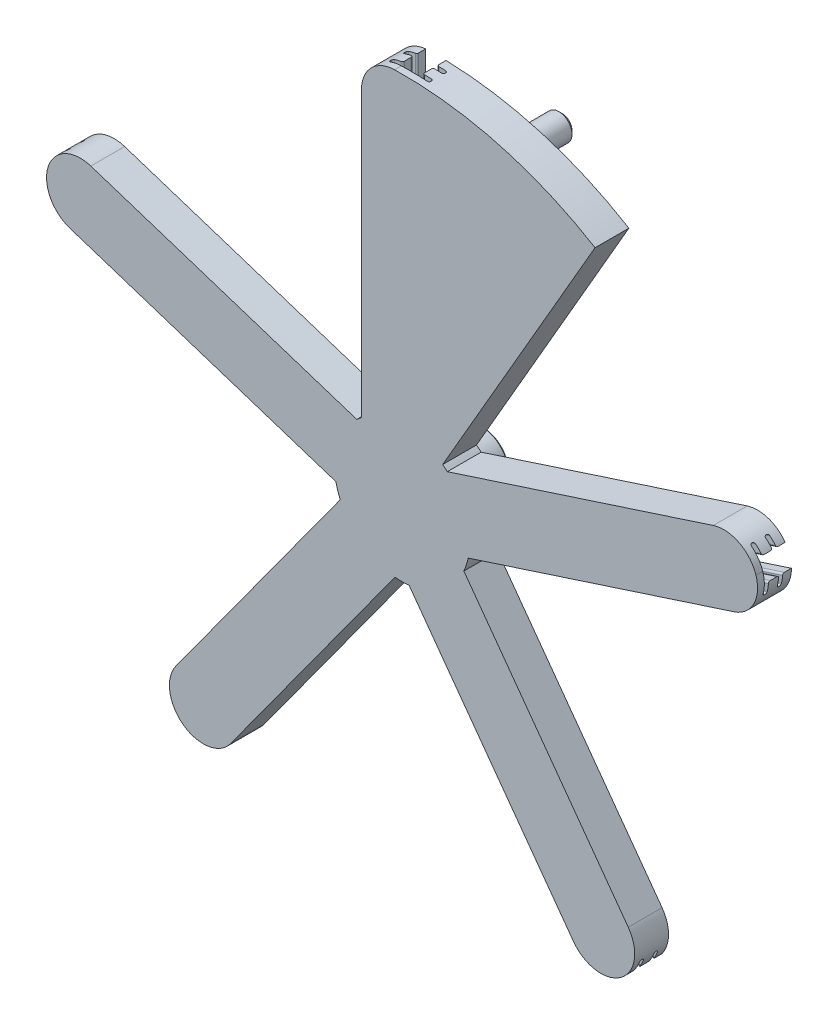
from build123d import *

# Parameters (mm, degrees)
BOSS_EXTRUDE1_DEPTH = 5
FILLET1_R           = 5
CUT_EXTRUDE2_DEPTH  = 51
CIRPATTERN1_COUNT   = 5
SKETCH3_R           = 1.95
BOSS_EXTRUDE2_DEPTH = 7
CHAMFER1_SIZE       = 0.5
SKETCH4_R           = 3.975
BOSS_EXTRUDE3_DEPTH = 7
CHAMFER2_SIZE       = 0.25


with BuildPart() as part:
    # Sketch1 → Boss-Extrude1 (new body)
    with BuildSketch(Plane.XY):
        with BuildLine():
            Line((-50.546425772, 21.680840429), (-6.691306064, 7.431448255))
            ThreePointArc((-6.691306064, 7.431448255), (-6.35201741, 7.723462619), (-6, 8))
            Line((-6, 8), (-6, 54.671747731))
            ThreePointArc((-6, 54.671747731), (11.896337599, 53.698018136), (28.529394067, 47.022055188))
            Line((28.529394067, 47.022055188), (6, 8))
            ThreePointArc((6, 8), (6.35201741, 7.723462619), (6.691306064, 7.431448255))
            Line((6.691306064, 7.431448255), (50.546425772, 21.680840429))
            ThreePointArc((50.546425772, 21.680840429), (52.308108396, 16.995934691), (53.636595716, 12.170275266))
            Line((53.636595716, 12.170275266), (9.781476007, -2.079116908))
            ThreePointArc((9.781476007, -2.079116908), (9.510565163, -3.090169944), (9.135454576, -4.067366431))
            Line((9.135454576, -4.067366431), (36.239409137, -41.372759461))
            ThreePointArc((36.239409137, -41.372759461), (32.328188876, -44.495934691), (28.149239193, -47.250611984))
            Line((28.149239193, -47.250611984), (1.045284633, -9.945218954))
            ThreePointArc((1.045284633, -9.945218954), (0, -10), (-1.045284633, -9.945218954))
            Line((-1.045284633, -9.945218954), (-28.149239193, -47.250611984))
            ThreePointArc((-28.149239193, -47.250611984), (-32.328188876, -44.495934691), (-36.239409137, -41.372759461))
            Line((-36.239409137, -41.372759461), (-9.135454576, -4.067366431))
            ThreePointArc((-9.135454576, -4.067366431), (-9.510565163, -3.090169944), (-9.781476007, -2.079116908))
            Line((-9.781476007, -2.079116908), (-53.636595716, 12.170275266))
            ThreePointArc((-53.636595716, 12.170275266), (-52.308108396, 16.995934691), (-50.546425772, 21.680840429))
        make_face()
    extrude(amount=BOSS_EXTRUDE1_DEPTH)

    # Fillet1
    fillet1_edges = [part.edges().sort_by_distance(p)[0] for p in [
        (50.546425772, 21.680840429, 2.5),
        (53.636595716, 12.170275266, 2.5),
        (36.239409137, -41.372759461, 2.5),
        (28.149239193, -47.250611984, 2.5),
        (-28.149239193, -47.250611984, 2.5),
        (-36.239409137, -41.372759461, 2.5),
        (-53.636595716, 12.170275266, 2.5),
        (-50.546425772, 21.680840429, 2.5),
        (-6, 54.671747731, 2.5),
    ]]
    fillet(fillet1_edges, radius=FILLET1_R - 0.0001)  # a hair under: the kernel refuses the full size

    # Sketch2 → Cut-Extrude2 (cut)
    with BuildSketch(Plane(origin=(-5.090369605, -7.006292692, 0), x_dir=(0.8090169943749478, -0.5877852522924728, 0), z_dir=(0.5877852522924728, 0.8090169943749478, 0))):
        with BuildLine():
            Line((0, 0), (1.5, 0))
            Line((1.5, 0), (1.5, -1.05))
            ThreePointArc((1.5, -1.05), (1.573223305, -1.226776695), (1.75, -1.3))
            Line((1.75, -1.3), (2.75, -1.3))
            ThreePointArc((2.75, -1.3), (2.926776695, -1.373223305), (3, -1.55))
            Line((3, -1.55), (3, -1.65))
            ThreePointArc((3, -1.65), (2.926776695, -1.826776695), (2.75, -1.9))
            Line((2.75, -1.9), (1.75, -1.9))
            ThreePointArc((1.75, -1.9), (1.573223305, -1.973223305), (1.5, -2.15))
            Line((1.5, -2.15), (1.5, -3.15))
            ThreePointArc((1.5, -3.15), (1.573223305, -3.326776695), (1.75, -3.4))
            Line((1.75, -3.4), (2.75, -3.4))
            ThreePointArc((2.75, -3.4), (2.926776695, -3.473223305), (3, -3.65))
            Line((3, -3.65), (3, -3.75))
            ThreePointArc((3, -3.75), (2.926776695, -3.926776695), (2.75, -4))
            Line((2.75, -4), (-2.75, -4))
            ThreePointArc((-2.75, -4), (-2.926776695, -3.926776695), (-3, -3.75))
            Line((-3, -3.75), (-3, -3.65))
            ThreePointArc((-3, -3.65), (-2.926776695, -3.473223305), (-2.75, -3.4))
            Line((-2.75, -3.4), (-1.75, -3.4))
            ThreePointArc((-1.75, -3.4), (-1.573223305, -3.326776695), (-1.5, -3.15))
            Line((-1.5, -3.15), (-1.5, -2.15))
            ThreePointArc((-1.5, -2.15), (-1.573223305, -1.973223305), (-1.75, -1.9))
            Line((-1.75, -1.9), (-2.75, -1.9))
            ThreePointArc((-2.75, -1.9), (-2.926776695, -1.826776695), (-3, -1.65))
            Line((-3, -1.65), (-3, -1.55))
            ThreePointArc((-3, -1.55), (-2.926776695, -1.373223305), (-2.75, -1.3))
            Line((-2.75, -1.3), (-1.75, -1.3))
            ThreePointArc((-1.75, -1.3), (-1.573223305, -1.226776695), (-1.5, -1.05))
            Line((-1.5, -1.05), (-1.5, 0))
            Line((-1.5, 0), (0, 0))
        make_face()
    cut_extrude2 = extrude(amount=-CUT_EXTRUDE2_DEPTH, mode=Mode.SUBTRACT)

    # CirPattern1: Cut-Extrude2 ×5 about axis
    cirpattern1_axis = Axis((0, 0, 0), (0, 0, 1))
    for i in range(1, CIRPATTERN1_COUNT):
        add(cut_extrude2.rotate(cirpattern1_axis, i * 360 / CIRPATTERN1_COUNT), mode=Mode.SUBTRACT)

    # Sketch3 → Boss-Extrude2 (add)
    with BuildSketch(Plane(origin=(0, 0, 0), x_dir=(-1, 0, 0), z_dir=(0, 0, -1))):
        with Locations(Location((-11.672048202, 48.320258596, 0), (0, 0, 180))):
            Circle(SKETCH3_R)
    extrude(amount=BOSS_EXTRUDE2_DEPTH)

    # Chamfer1
    chamfer1_edges = [part.edges().sort_by_distance(p)[0] for p in [
        (9.722048202, 48.320258596, -7),
    ]]
    chamfer(chamfer1_edges, length=CHAMFER1_SIZE)

    # Sketch4 → Boss-Extrude3 (add)
    with BuildSketch(Plane(origin=(0, 0, 0), x_dir=(-1, 0, 0), z_dir=(0, 0, -1))):
        with Locations(Location((0, 0, 0), (0, 0, 180))):
            Circle(SKETCH4_R)
    extrude(amount=BOSS_EXTRUDE3_DEPTH)

    # Chamfer2
    chamfer2_edges = [part.edges().sort_by_distance(p)[0] for p in [
        (-3.975, 0, -7),
    ]]
    chamfer(chamfer2_edges, length=CHAMFER2_SIZE)


solid = part.part
